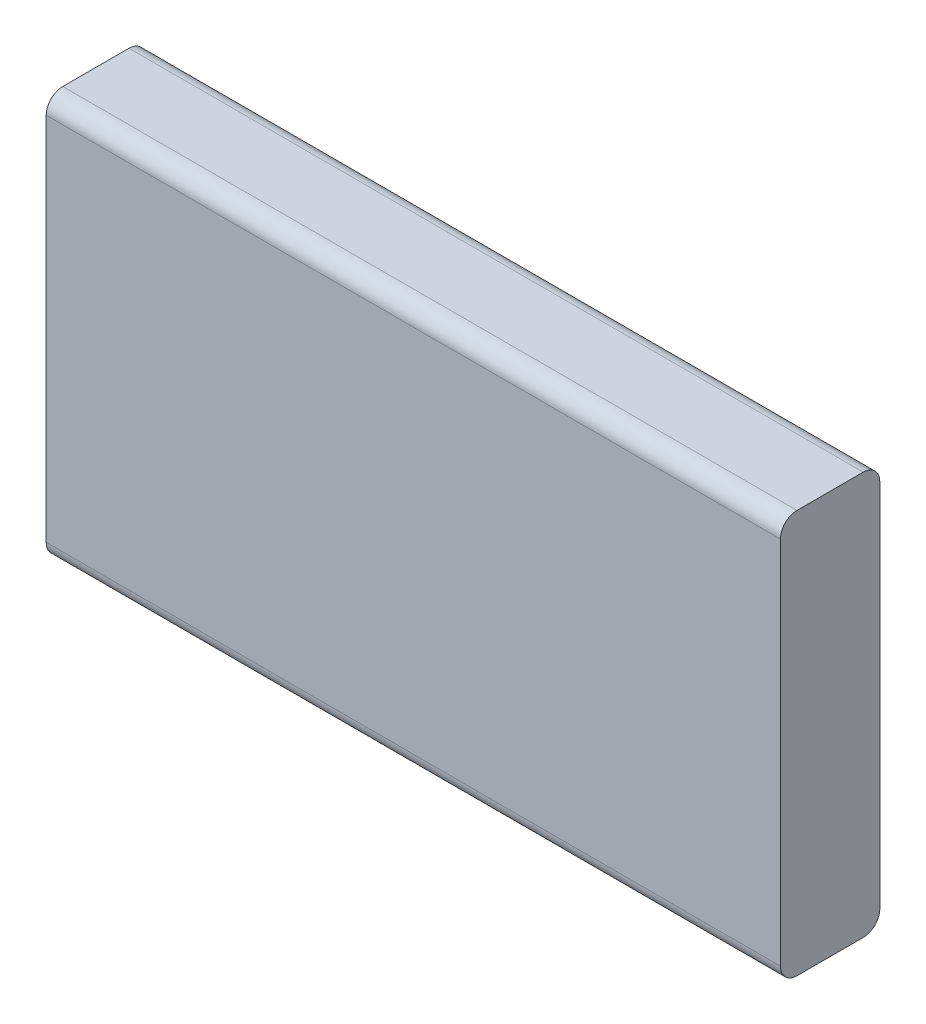
from build123d import *

# Parameters (mm, degrees)
ESBO_O1_W                = 133
ESBO_O1_H                = 73
RESSALTO_EXTRUS_O1_DEPTH = 18
FILETE1_R                = 3


with BuildPart() as part:
    # Esboço1 → Ressalto-extrusão1 (new body)
    with BuildSketch(Plane.XY):
        with Locations((-19.328171864, 2.304966448)):
            Rectangle(ESBO_O1_W, ESBO_O1_H)
    extrude(amount=RESSALTO_EXTRUS_O1_DEPTH)

    # Filete1
    filete1_edges = [part.edges().sort_by_distance(p)[0] for p in [
        (-19.328171864, -34.195033552, 0),
        (-19.328171864, -34.195033552, 18),
        (-19.328171864, 38.804966448, 18),
        (-19.328171864, 38.804966448, 0),
    ]]
    fillet(filete1_edges, radius=FILETE1_R)


solid = part.part
